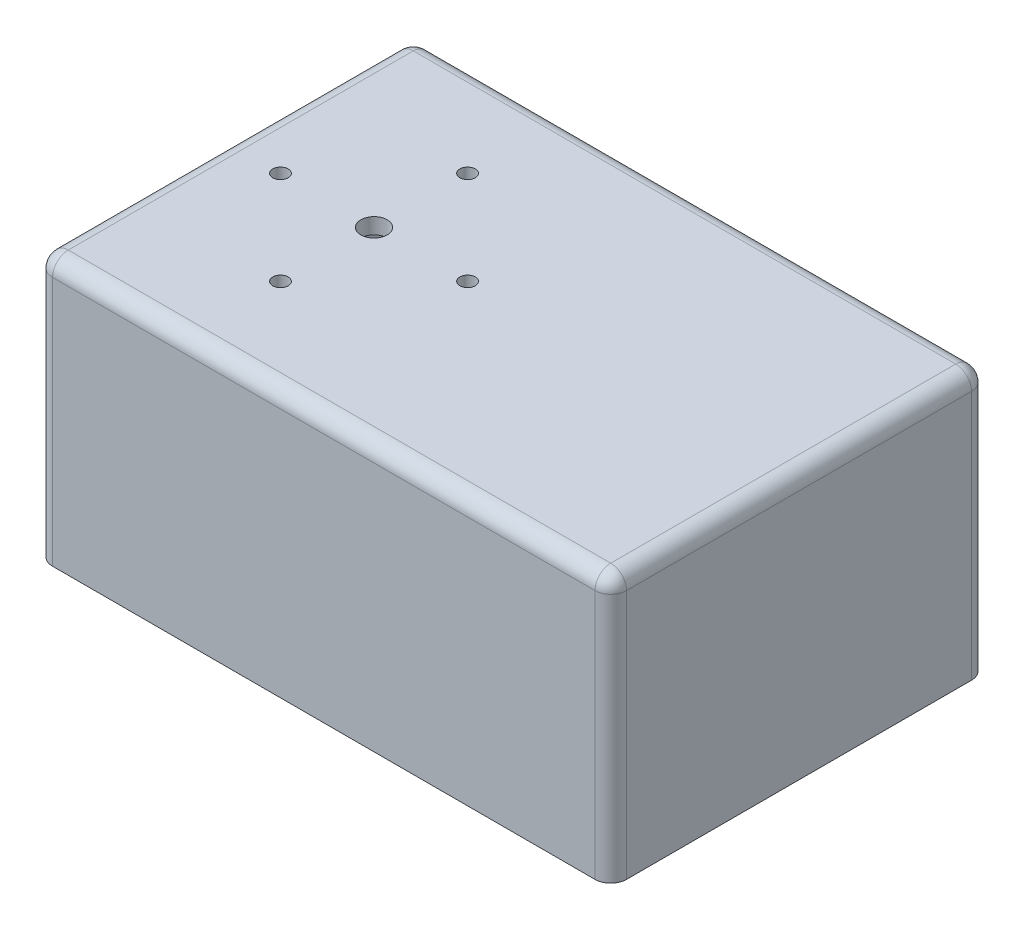
from build123d import *

# Parameters (mm, degrees)
SKETCH1_W           = 218
SKETCH1_H           = 143
BOSS_EXTRUDE1_DEPTH = 101
FILLET1_R           = 6
SHELL1_START        = -103
SHELL1_OUTLINE_W    = 95
SHELL1_OUTLINE_H    = 131
SHELL1_DEPTH        = 206
SKETCH2_R           = 5
SKETCH2_R_2         = 2.925
CUT_EXTRUDE1_DEPTH  = 165.906791855


# Read off the part's stored shape, not the designer's step: Shell1
with BuildPart() as part:
    # Sketch1 → Boss-Extrude1 (new body)
    with BuildSketch(Plane(origin=(0, 0, 0), x_dir=(1, 0, 0), z_dir=(0, 1, 0))):
        Rectangle(SKETCH1_W, SKETCH1_H)
    extrude(amount=BOSS_EXTRUDE1_DEPTH)

    # Fillet1
    fillet1_edges = [part.edges().sort_by_distance(p)[0] for p in [
        (-109, 101, 0),
        (0, 101, 71.5),
        (109, 101, 0),
        (109, 50.5, 71.5),
        (-109, 50.5, 71.5),
        (-109, 50.5, -71.5),
        (109, 50.5, -71.5),
        (0, 101, -71.5),
    ]]
    fillet(fillet1_edges, radius=FILLET1_R)

    # Shell1 outline → Shell1 (cut)
    with BuildSketch(Plane.YZ.offset(SHELL1_START)):
        with Locations((47.5, 0)):
            Rectangle(SHELL1_OUTLINE_W, SHELL1_OUTLINE_H)
    extrude(amount=SHELL1_DEPTH, mode=Mode.SUBTRACT)

    # Sketch2 → Cut-Extrude1 (cut, through all)
    with BuildSketch(Plane(origin=(0, 101, 0), x_dir=(1, 0, 0), z_dir=(0, 1, 0))):
        with Locations(Location((-52.4, 0, 0), (0, 0, 270))):
            Circle(SKETCH2_R)
        with Locations(Location((-52.4, 35.525, 0), (0, 0, 270))):
            Circle(SKETCH2_R_2)
        with Locations(Location((-87.925, 0, 0), (0, 0, 270))):
            Circle(SKETCH2_R_2)
        with Locations(Location((-52.4, -35.525, 0), (0, 0, 270))):
            Circle(SKETCH2_R_2)
        with Locations(Location((-16.875, 0, 0), (0, 0, 270))):
            Circle(SKETCH2_R_2)
    extrude(amount=-CUT_EXTRUDE1_DEPTH, mode=Mode.SUBTRACT)


solid = part.part
